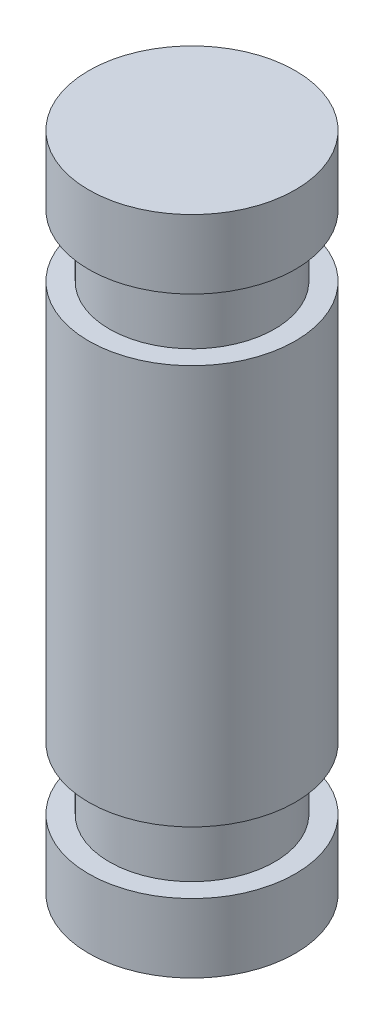
from build123d import *


with BuildPart() as part:
    # Sketch1 → Revolve1 (revolve)
    with BuildSketch(Plane.YZ):
        Polygon((0, 0), (4.8, 0), (4.8, 1.5), (3.8, 1.5), (3.8, 1.2), (2.9, 1.2), (2.9, 1.5), (-2.9, 1.5), (-2.9, 1.2), (-3.8, 1.2), (-3.8, 1.5), (-4.8, 1.5), (-4.8, 0), align=None)
    revolve(axis=Axis((0, 4.8, 0), (0, 1, 0)))


solid = part.part
